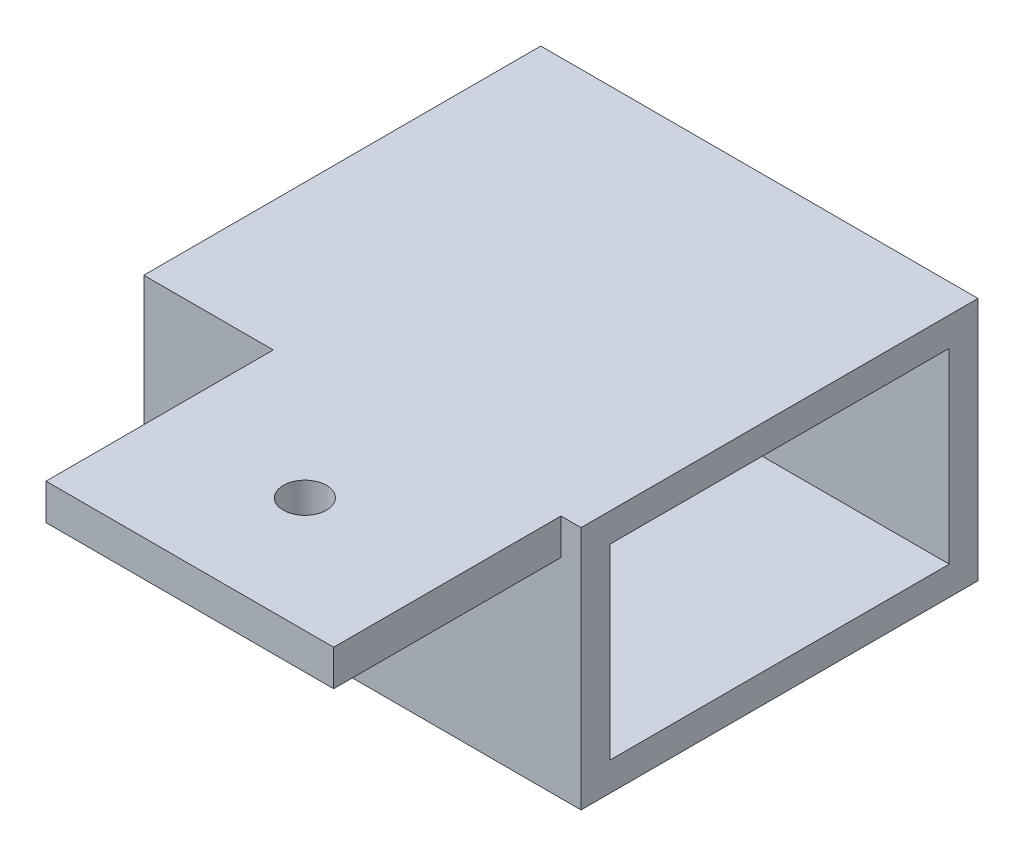
from build123d import *

# Parameters (mm, degrees)
S_BOX1_W       = 20
S_BOX1_H       = 2.5
BOSS_1_DEPTH   = 42
S_BOX2_W       = 30.4
S_BOX2_H       = 17
BOSS_2_DEPTH   = 27.6
S_CUT3_W       = 30.6
S_CUT3_H       = 13
POCKET_3_DEPTH = 23.6
S_HOLE4_R      = 1.5
HOLE_4_DEPTH   = 2.7


with BuildPart() as part:
    # S_box1 → Boss_1 (new body)
    with BuildSketch(Plane.XY.offset(-34)):
        with Locations((0, -2.75)):
            Rectangle(S_BOX1_W, S_BOX1_H)
    extrude(amount=BOSS_1_DEPTH)

    # S_box2 → Boss_2 (add)
    with BuildSketch(Plane.XY.offset(-35.4)):
        with Locations((-3.8, -10)):
            Rectangle(S_BOX2_W, S_BOX2_H)
    extrude(amount=BOSS_2_DEPTH)

    # S_cut3 → Pocket_3 (cut)
    with BuildSketch(Plane.XY.offset(-33.4)):
        with Locations((-3.8, -10)):
            Rectangle(S_CUT3_W, S_CUT3_H)
    extrude(amount=POCKET_3_DEPTH, mode=Mode.SUBTRACT)

    # S_hole4 → Hole_4 (cut)
    with BuildSketch(Plane(origin=(0, -4.1, 0), x_dir=(1, 0, 0), z_dir=(0, 1, 0))):
        Circle(S_HOLE4_R)
    extrude(amount=HOLE_4_DEPTH, mode=Mode.SUBTRACT)


solid = part.part
